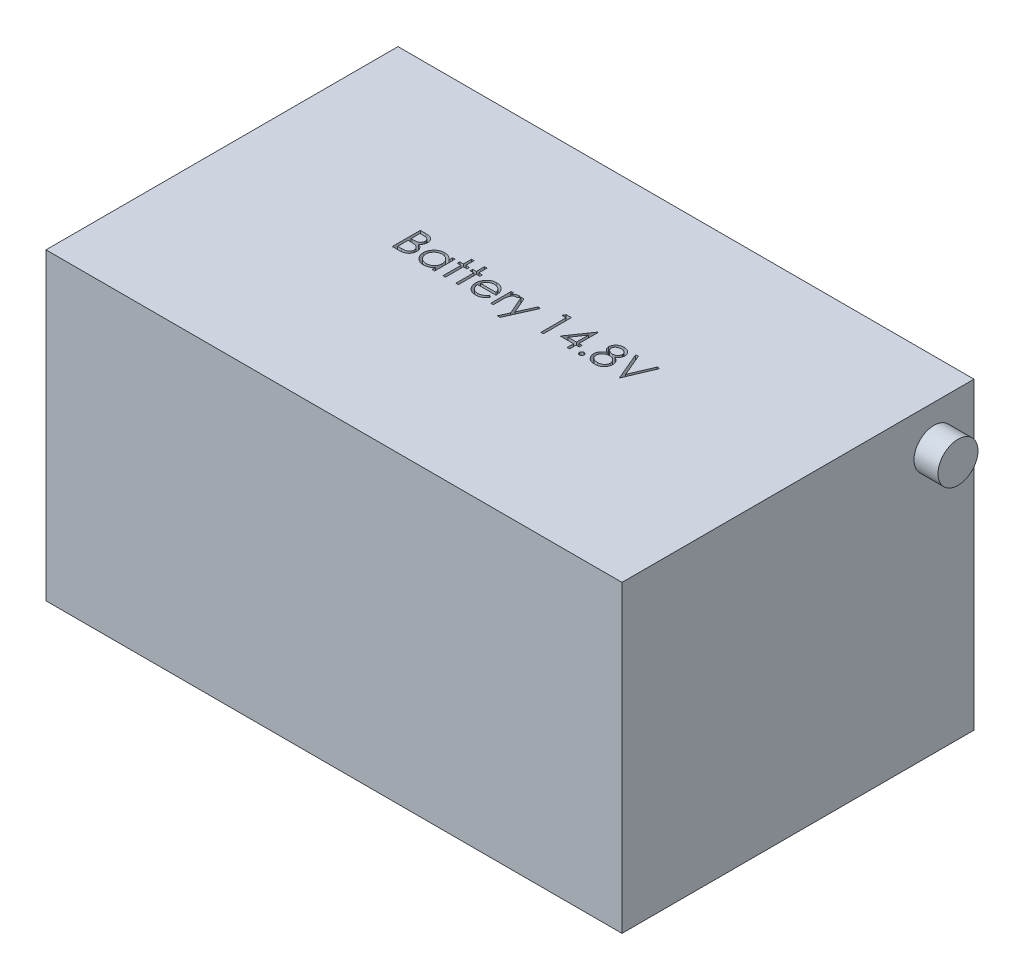
from build123d import *

# Parameters (mm, degrees)
SKETCH_1_W      = 72
SKETCH_1_H      = 38
EXTRUDE_1_DEPTH = 22
WRAP_START      = -3
WRAP_1_DEPTH    = 4
SKETCH_3_R      = 2.5
EXTRUDE_2_DEPTH = 3


with BuildPart() as part:
    # 草圖1 → 填料-伸長1 (new, symmetric)
    with BuildSketch(Plane.XY):
        Rectangle(SKETCH_1_W, SKETCH_1_H)
    extrude(amount=EXTRUDE_1_DEPTH, both=True)

    # 包覆1: read off the stored shape, not the designer's step
    # 包覆1 outline → 包覆1 (cut)
    # profile 1 of 12: a face of its own
    with BuildSketch(Plane(origin=(0, 19, 0), x_dir=(1, 0, 0), z_dir=(0, 1, 0)).offset(WRAP_START)):
        with BuildLine():
            add(Edge.make_bspline(
                [(11.850659884, 1.01943109), (11.849888464, 0.985733357), (11.848361533, 0.9190329), (11.835061549, 0.820586789), (11.815148571, 0.724975007), (11.786069058, 0.632218516), (11.748355667, 0.542829143), (11.701878831, 0.456730369), (11.649267626, 0.37251106), (11.607015387, 0.320691659), (11.585635846, 0.294471154)],
                knots=[0, 0, 0, 0, 0.128158186, 0.253673136, 0.377325306, 0.499384555, 0.622918368, 0.745839393, 0.871395285, 1, 1, 1, 1], degree=3))
            add(Edge.make_bspline(
                [(11.174077352, 1.949819712), (11.202725899, 1.934881756), (11.258600134, 1.905747753), (11.338177342, 1.858836925), (11.410902343, 1.80939596), (11.478792905, 1.759760101), (11.540656256, 1.708028449), (11.595800669, 1.653995293), (11.645588289, 1.599009348), (11.689015073, 1.542139508), (11.72721191, 1.483536859), (11.760224045, 1.423047586), (11.788441248, 1.360804252), (11.810804186, 1.296127422), (11.829225978, 1.22996716), (11.841901583, 1.161469178), (11.848718501, 1.091084837), (11.850007314, 1.043516536), (11.850659884, 1.01943109)],
                knots=[0, 0, 0, 0, 0.07952483, 0.155099976, 0.22721982, 0.295910504, 0.362055881, 0.425520117, 0.485812719, 0.544494706, 0.601459636, 0.657840594, 0.713974472, 0.769467952, 0.826129967, 0.882885359, 0.940700882, 1, 1, 1, 1], degree=3))
            add(Edge.make_bspline(
                [(11.671172705, 2.681790865), (11.669738144, 2.643814202), (11.666920749, 2.569230192), (11.643220809, 2.460503672), (11.603307496, 2.358681633), (11.548813333, 2.262608681), (11.477787845, 2.174027183), (11.391179112, 2.091810713), (11.289677634, 2.015283885), (11.213416748, 1.972097521), (11.174077352, 1.949819712)],
                knots=[0, 0, 0, 0, 0.121904041, 0.239412608, 0.355410104, 0.472090729, 0.592858982, 0.718703468, 0.854892383, 1, 1, 1, 1], degree=3))
            add(Edge.make_bspline(
                [(10.677683121, 3.58974359), (10.722186936, 3.588297247), (10.80994339, 3.585445223), (10.938938017, 3.561658345), (11.062362895, 3.521928825), (11.179792394, 3.468031602), (11.289124261, 3.401644661), (11.38572657, 3.321243787), (11.471059152, 3.231102236), (11.541643547, 3.130182633), (11.599806436, 3.023498439), (11.640307337, 2.911875918), (11.666259311, 2.797726859), (11.669532675, 2.720488855), (11.671172705, 2.681790865)],
                knots=[0, 0, 0, 0, 0.089409711, 0.176305764, 0.262625902, 0.349445726, 0.435498264, 0.51892813, 0.601354657, 0.684256422, 0.76580674, 0.844876866, 0.922279795, 1, 1, 1, 1], degree=3))
            add(Edge.make_bspline(
                [(9.651941936, 2.691606571), (9.65357736, 2.728904129), (9.656864847, 2.803878726), (9.683448168, 2.915484849), (9.726768234, 3.025101414), (9.785689231, 3.132197127), (9.859076448, 3.233147342), (9.947122993, 3.323688288), (10.04772629, 3.40299977), (10.160384157, 3.469575943), (10.281620393, 3.523759602), (10.409536117, 3.561138025), (10.54190261, 3.585574141), (10.632000329, 3.588340796), (10.677683121, 3.58974359)],
                knots=[0, 0, 0, 0, 0.074058426, 0.148870352, 0.226667668, 0.307734759, 0.391157204, 0.473929356, 0.557927752, 0.64498929, 0.733364056, 0.821092042, 0.909287215, 1, 1, 1, 1], degree=3))
            add(Edge.make_bspline(
                [(10.163059724, 1.949819712), (10.122468349, 1.97195448), (10.043872086, 2.014813588), (9.939802645, 2.093560394), (9.850412022, 2.178848209), (9.778157304, 2.272478003), (9.721285076, 2.371524878), (9.682266472, 2.47536913), (9.655869988, 2.582085244), (9.653255161, 2.65499144), (9.651941936, 2.691606571)],
                knots=[0, 0, 0, 0, 0.14586006, 0.282425903, 0.4108504, 0.535029421, 0.654701078, 0.770133433, 0.884555844, 1, 1, 1, 1], degree=3))
            add(Edge.make_bspline(
                [(9.472454756, 0.990685096), (9.473032637, 1.015244288), (9.474174734, 1.06378192), (9.482079582, 1.135491248), (9.494788044, 1.205287383), (9.5120475, 1.273428127), (9.535438527, 1.339417399), (9.56368066, 1.403567873), (9.596612612, 1.465951972), (9.634693777, 1.526910853), (9.678995801, 1.585590365), (9.729159451, 1.64298636), (9.78618732, 1.698208227), (9.849444979, 1.751930652), (9.918209518, 1.805106626), (9.994267049, 1.854862354), (10.075601317, 1.904720319), (10.133406722, 1.934528645), (10.163059724, 1.949819712)],
                knots=[0, 0, 0, 0, 0.058853586, 0.116315459, 0.172674843, 0.228780387, 0.284580359, 0.340256506, 0.396629805, 0.453507263, 0.51231819, 0.572648444, 0.636021936, 0.702362946, 0.771483056, 0.844184477, 0.920069794, 1, 1, 1, 1], degree=3))
            add(Edge.make_bspline(
                [(10.656649468, -0.08974359), (10.609636079, -0.088591112), (10.5181528, -0.086348507), (10.384994922, -0.071154075), (10.260871853, -0.044526208), (10.145061884, -0.008081599), (10.038263191, 0.039328629), (9.94078009, 0.098337038), (9.851206118, 0.16656848), (9.772259644, 0.245982558), (9.7021712, 0.331040431), (9.640603147, 0.41879204), (9.589429069, 0.509245398), (9.546101973, 0.601051765), (9.512933951, 0.695497919), (9.48996174, 0.792097932), (9.475372426, 0.890683075), (9.473431291, 0.957214728), (9.472454756, 0.990685096)],
                knots=[0, 0, 0, 0, 0.078556433, 0.15286284, 0.223559693, 0.290374944, 0.355403073, 0.418291157, 0.480388564, 0.543072615, 0.604923944, 0.664398309, 0.721942555, 0.778374891, 0.833829941, 0.888861236, 0.94408894, 1, 1, 1, 1], degree=3))
            add(Edge.make_bspline(
                [(11.585635846, 0.294471154), (11.557799372, 0.26387738), (11.502470406, 0.203067887), (11.407687478, 0.124117077), (11.303665595, 0.057767683), (11.190807262, 0.003695788), (11.06941416, -0.038390071), (10.939512156, -0.068632588), (10.800848003, -0.085955018), (10.705542532, -0.088459007), (10.656649468, -0.08974359)],
                knots=[0, 0, 0, 0, 0.11928345, 0.237092882, 0.354796044, 0.474576301, 0.597460066, 0.724926155, 0.858883199, 1, 1, 1, 1], degree=3))
        make_face()
        with BuildLine():
            add(Edge.make_bspline(
                [(9.78655732, 0.980168269), (9.787920579, 0.948737363), (9.790625253, 0.88637918), (9.812081891, 0.794216108), (9.846517427, 0.704995054), (9.894542643, 0.619443101), (9.954010215, 0.539492995), (10.027136683, 0.469804219), (10.109377521, 0.40788274), (10.203515375, 0.357802207), (10.306343841, 0.317807352), (10.41783557, 0.290251389), (10.536390489, 0.272009939), (10.618250081, 0.270171758), (10.660155077, 0.269230769)],
                knots=[0, 0, 0, 0, 0.074898208, 0.148596294, 0.224471235, 0.302322742, 0.381918618, 0.461148696, 0.542417123, 0.626716083, 0.714596831, 0.80490292, 0.900127254, 1, 1, 1, 1], degree=3))
            add(Edge.make_bspline(
                [(10.680487609, 1.75), (10.649361823, 1.749446359), (10.588300627, 1.748360249), (10.498843698, 1.736270749), (10.412990533, 1.719441356), (10.331030597, 1.693910517), (10.2529985, 1.660714027), (10.178471817, 1.620779487), (10.108020688, 1.573574044), (10.042617961, 1.519697428), (9.982894632, 1.461637975), (9.930496332, 1.400175839), (9.885998811, 1.336453307), (9.85016556, 1.269661077), (9.820753828, 1.201213466), (9.801439951, 1.129405871), (9.78905824, 1.055618758), (9.787395608, 1.00545866), (9.78655732, 0.980168269)],
                knots=[0, 0, 0, 0, 0.071268693, 0.139811785, 0.206497432, 0.271535244, 0.336081831, 0.400528388, 0.464983843, 0.530050305, 0.594423409, 0.65558271, 0.714849106, 0.772115064, 0.828999211, 0.885122163, 0.942079353, 1, 1, 1, 1], degree=3))
            add(Edge.make_bspline(
                [(11.53655732, 1.013120994), (11.535651472, 1.036998334), (11.533865297, 1.084080279), (11.522528605, 1.153846806), (11.502612728, 1.22124962), (11.475285331, 1.287099626), (11.438904369, 1.350062576), (11.396059499, 1.411778748), (11.34436538, 1.470535192), (11.285952784, 1.526788288), (11.222293823, 1.578804025), (11.154626678, 1.624818464), (11.083472216, 1.66357058), (11.008981005, 1.695087075), (10.931318449, 1.719874545), (10.850541671, 1.73719054), (10.766556096, 1.748090143), (10.709501225, 1.749356189), (10.680487609, 1.75)],
                knots=[0, 0, 0, 0, 0.057339426, 0.113063332, 0.169181449, 0.22577456, 0.283826304, 0.343454279, 0.405906962, 0.47139226, 0.538002834, 0.603063556, 0.667601831, 0.732225443, 0.79700481, 0.86304799, 0.930356987, 1, 1, 1, 1], degree=3))
            add(Edge.make_bspline(
                [(10.660155077, 0.269230769), (10.692905445, 0.269859578), (10.756713663, 0.271084698), (10.849799612, 0.281898992), (10.937644161, 0.299048617), (11.020076959, 0.323992163), (11.098020799, 0.354442139), (11.170154153, 0.393614221), (11.23833268, 0.438166544), (11.299196803, 0.491024701), (11.354630012, 0.547504195), (11.402963304, 0.607294238), (11.444920856, 0.668769871), (11.477851811, 0.733320355), (11.504178065, 0.79970727), (11.52310162, 0.868542781), (11.534777835, 0.940038014), (11.535958731, 0.988537085), (11.53655732, 1.013120994)],
                knots=[0, 0, 0, 0, 0.076558933, 0.149161352, 0.218826846, 0.285567139, 0.350313106, 0.414125154, 0.477179161, 0.540368019, 0.60220239, 0.662033654, 0.719934407, 0.775907433, 0.831114864, 0.886667447, 0.942552362, 1, 1, 1, 1], degree=3))
        make_face(mode=Mode.SUBTRACT)
        with BuildLine():
            add(Edge.make_bspline(
                [(9.9660445, 2.686698718), (9.966731867, 2.668418208), (9.968090202, 2.632293295), (9.97859533, 2.578947429), (9.994252185, 2.526525793), (10.018902847, 2.476274882), (10.048469205, 2.426451522), (10.084960681, 2.378300936), (10.128449709, 2.331655552), (10.177477149, 2.28691211), (10.230888687, 2.245013347), (10.28747273, 2.208640166), (10.346519122, 2.178206055), (10.407421191, 2.152876651), (10.470799638, 2.133186713), (10.536266112, 2.119218067), (10.603831614, 2.11053607), (10.649612195, 2.109499049), (10.672775269, 2.108974359)],
                knots=[0, 0, 0, 0, 0.05456395, 0.107826203, 0.161923709, 0.217509701, 0.274498333, 0.334814765, 0.397554947, 0.464754577, 0.53290121, 0.600097214, 0.665354161, 0.731083628, 0.796883494, 0.86329159, 0.930831218, 1, 1, 1, 1], degree=3))
            add(Edge.make_bspline(
                [(10.660155077, 3.230769231), (10.635604271, 3.23011779), (10.58757216, 3.228843288), (10.517143488, 3.222184651), (10.450171121, 3.209231434), (10.385955321, 3.191992722), (10.325376508, 3.168704734), (10.267611954, 3.141309725), (10.213644764, 3.108003659), (10.162823461, 3.070642462), (10.117072686, 3.029549555), (10.076468135, 2.986735837), (10.042740021, 2.941360445), (10.014098911, 2.894552085), (9.993317394, 2.844921509), (9.97775309, 2.793990332), (9.967231698, 2.741114948), (9.966443308, 2.704978438), (9.9660445, 2.686698718)],
                knots=[0, 0, 0, 0, 0.075243309, 0.147208812, 0.21644709, 0.284025042, 0.350655449, 0.415031318, 0.479629831, 0.544651634, 0.60804424, 0.667827565, 0.725114247, 0.780991708, 0.835527004, 0.889438155, 0.944072089, 1, 1, 1, 1], degree=3))
            add(Edge.make_bspline(
                [(11.357070141, 2.693709936), (11.356538243, 2.710337972), (11.355482503, 2.74334224), (11.346782447, 2.792080605), (11.332406614, 2.839710189), (11.312943534, 2.886624459), (11.287333739, 2.932165191), (11.256969551, 2.977048279), (11.22008505, 3.020264043), (11.178688617, 3.062819592), (11.131743208, 3.102203615), (11.079339296, 3.136838326), (11.021745545, 3.166250682), (10.958960595, 3.190139437), (10.891215671, 3.208081787), (10.818822797, 3.221518134), (10.74117835, 3.229091246), (10.687748599, 3.230197771), (10.660155077, 3.230769231)],
                knots=[0, 0, 0, 0, 0.050902438, 0.101034043, 0.151083817, 0.203061988, 0.256248434, 0.310846715, 0.3687691, 0.43001504, 0.492519647, 0.556048722, 0.621995683, 0.690192369, 0.761384855, 0.83635622, 0.915487005, 1, 1, 1, 1], degree=3))
            add(Edge.make_bspline(
                [(10.672775269, 2.108974359), (10.702525373, 2.109847226), (10.76173174, 2.111584339), (10.849011072, 2.127735513), (10.933873716, 2.153141431), (11.015412621, 2.187901397), (11.091517206, 2.231529257), (11.159357274, 2.283762275), (11.218354167, 2.343394372), (11.267894777, 2.409497208), (11.306304624, 2.479848796), (11.336206432, 2.550449089), (11.353667647, 2.62205132), (11.355945214, 2.670018284), (11.357070141, 2.693709936)],
                knots=[0, 0, 0, 0, 0.089689936, 0.17849401, 0.266837753, 0.356558176, 0.44533425, 0.530805835, 0.614076217, 0.697707086, 0.77914195, 0.855353591, 0.92855682, 1, 1, 1, 1], degree=3))
        make_face(mode=Mode.SUBTRACT)
    # profile 2 of 12: a face of its own
    with BuildSketch(Plane(origin=(0, 19, 0), x_dir=(1, 0, 0), z_dir=(0, 1, 0)).offset(WRAP_START)):
        with BuildLine():
            add(Edge.make_bspline(
                [(9.023736807, 0.246794872), (9.022541207, 0.227551542), (9.0201835, 0.189603978), (9.004920891, 0.134322516), (8.976022841, 0.084695611), (8.939787848, 0.039393473), (8.894991415, 0.002452603), (8.844889568, -0.024970742), (8.78989831, -0.041662722), (8.751581987, -0.043789019), (8.732070141, -0.044871795)],
                knots=[0, 0, 0, 0, 0.126177718, 0.248820607, 0.371539969, 0.499983707, 0.627244198, 0.749225521, 0.87229795, 1, 1, 1, 1], degree=3))
            add(Edge.make_bspline(
                [(8.732070141, 0.538461538), (8.751560353, 0.537303372), (8.789768635, 0.535032921), (8.845007764, 0.519456248), (8.895002423, 0.491797587), (8.939534668, 0.454934809), (8.976241145, 0.410239146), (9.004885497, 0.360643237), (9.020326482, 0.304941644), (9.022580394, 0.266511969), (9.023736807, 0.246794872)],
                knots=[0, 0, 0, 0, 0.127518927, 0.249985948, 0.371792352, 0.498870353, 0.625948354, 0.748491738, 0.870958759, 1, 1, 1, 1], degree=3))
            add(Edge.make_bspline(
                [(8.440403474, 0.246794872), (8.441465573, 0.266544251), (8.443539192, 0.305102491), (8.460314852, 0.360301599), (8.487691064, 0.410470038), (8.524696459, 0.454866618), (8.569220755, 0.492053921), (8.61951696, 0.519118714), (8.6745565, 0.535159126), (8.712566439, 0.537341643), (8.732070141, 0.538461538)],
                knots=[0, 0, 0, 0, 0.129096958, 0.252045967, 0.373904964, 0.501037835, 0.628170706, 0.751376463, 0.872426013, 1, 1, 1, 1], degree=3))
            add(Edge.make_bspline(
                [(8.732070141, -0.044871795), (8.712544235, -0.043828198), (8.674424552, -0.041790823), (8.619638558, -0.024628016), (8.56923159, 0.002195444), (8.524443878, 0.039462353), (8.487905406, 0.084462497), (8.460280023, 0.134664293), (8.443689874, 0.189445731), (8.441508002, 0.227520373), (8.440403474, 0.246794872)],
                knots=[0, 0, 0, 0, 0.127756603, 0.249414355, 0.372796476, 0.500111333, 0.628609941, 0.750643374, 0.873768379, 1, 1, 1, 1], degree=3))
        make_face()
    # profile 3 of 12: a face of its own
    with BuildSketch(Plane(origin=(0, 19, 0), x_dir=(1, 0, 0), z_dir=(0, 1, 0)).offset(WRAP_START)):
        with BuildLine():
            add(Edge.make_bspline(
                [(-2.104468321, 2.181189904), (-2.081279562, 2.216245732), (-2.036931241, 2.283289731), (-1.963218312, 2.371959032), (-1.887714981, 2.445374079), (-1.810059793, 2.503877598), (-1.729681693, 2.547690717), (-1.648344742, 2.579783752), (-1.564769272, 2.598761067), (-1.508607347, 2.601294726), (-1.480469923, 2.602564103)],
                knots=[0, 0, 0, 0, 0.160059412, 0.306112383, 0.438366514, 0.560541455, 0.675317225, 0.786113634, 0.892841788, 1, 1, 1, 1], degree=3))
            Line((-2.104468321, 2.181189904), (-2.104468321, 2.557692308))
            Line((-2.104468321, 2.557692308), (-2.418570885, 2.557692308))
            Line((-2.418570885, 2.557692308), (-2.418570885, 0))
            Line((-2.418570885, 0), (-2.104468321, 0))
            Line((-2.104468321, 0), (-2.104468321, 0.859575321))
            add(Edge.make_bspline(
                [(-2.048378577, 1.737379808), (-2.053110971, 1.717102634), (-2.063592862, 1.672190235), (-2.0737844, 1.596841711), (-2.083853918, 1.507818052), (-2.090950536, 1.404871459), (-2.097528579, 1.288259015), (-2.101238661, 1.15780307), (-2.104341801, 1.013369718), (-2.104424868, 0.912395365), (-2.104468321, 0.859575321)],
                knots=[0, 0, 0, 0, 0.070854869, 0.15693815, 0.258600395, 0.37589093, 0.508166168, 0.656237809, 0.82017677, 1, 1, 1, 1], degree=3))
            add(Edge.make_bspline(
                [(-1.540065276, 2.288461538), (-1.565271009, 2.286781501), (-1.616683399, 2.283354712), (-1.692167899, 2.256415904), (-1.765415104, 2.212890664), (-1.823586767, 2.164619552), (-1.86862902, 2.118071755), (-1.900769245, 2.077423352), (-1.930251992, 2.031844721), (-1.958422212, 1.982115037), (-1.984088507, 1.927385191), (-2.008043176, 1.868201977), (-2.029702039, 1.804496849), (-2.042052283, 1.760114328), (-2.048378577, 1.737379808)],
                knots=[0, 0, 0, 0, 0.093806529, 0.191338128, 0.295190617, 0.410312337, 0.471930251, 0.536425159, 0.603118728, 0.674117672, 0.749332023, 0.828283384, 0.912039809, 1, 1, 1, 1], degree=3))
            add(Edge.make_bspline(
                [(-1.379508385, 2.242888622), (-1.394617406, 2.249628888), (-1.423297221, 2.262423203), (-1.465251787, 2.277565213), (-1.503933124, 2.286481129), (-1.528576682, 2.287831847), (-1.540065276, 2.288461538)],
                knots=[0, 0, 0, 0, 0.295138801, 0.560229945, 0.794983357, 1, 1, 1, 1], degree=3))
            Line((-1.379508385, 2.242888622), (-1.207032423, 2.514923878))
            add(Edge.make_bspline(
                [(-1.480469923, 2.602564103), (-1.458643597, 2.601373576), (-1.413734512, 2.59892399), (-1.345751922, 2.581713165), (-1.27570847, 2.554235143), (-1.230566083, 2.52839492), (-1.207032423, 2.514923878)],
                knots=[0, 0, 0, 0, 0.225277548, 0.463523195, 0.720323555, 1, 1, 1, 1], degree=3))
        make_face()
    # profile 4 of 12: a face of its own
    with BuildSketch(Plane(origin=(0, 19, 0), x_dir=(1, 0, 0), z_dir=(0, 1, 0)).offset(WRAP_START)):
        with BuildLine():
            add(Edge.make_bspline(
                [(-3.091647808, 0.661157853), (-3.113884403, 0.621714521), (-3.157148012, 0.544973418), (-3.23154876, 0.439541558), (-3.309540832, 0.344693842), (-3.3946448, 0.262964188), (-3.484314479, 0.191712803), (-3.579047134, 0.129374978), (-3.679335952, 0.076256458), (-3.785185676, 0.03150393), (-3.897485228, -0.002905564), (-4.016506744, -0.027209785), (-4.142478239, -0.042233054), (-4.228824419, -0.043978194), (-4.273038032, -0.044871795)],
                knots=[0, 0, 0, 0, 0.093369857, 0.181660766, 0.265874227, 0.346354784, 0.424599862, 0.501903184, 0.579992091, 0.658443431, 0.738672236, 0.821894148, 0.908800792, 1, 1, 1, 1], degree=3))
            Line((-3.091647808, 0.661157853), (-3.370694282, 0.807692308))
            add(Edge.make_bspline(
                [(-4.312300853, 0.269230769), (-4.280949705, 0.269838826), (-4.218743014, 0.271045327), (-4.126102157, 0.282777238), (-4.03496263, 0.301747513), (-3.945701646, 0.327637504), (-3.8601308, 0.359214356), (-3.78088525, 0.397317213), (-3.708005035, 0.43946696), (-3.639888068, 0.487676635), (-3.573817075, 0.546684822), (-3.508274588, 0.620320543), (-3.437997935, 0.707408071), (-3.394008342, 0.772953737), (-3.370694282, 0.807692308)],
                knots=[0, 0, 0, 0, 0.082592263, 0.163878894, 0.24565874, 0.327725695, 0.408609961, 0.485749086, 0.559169056, 0.630268476, 0.705306028, 0.792064966, 0.889796437, 1, 1, 1, 1], degree=3))
            add(Edge.make_bspline(
                [(-5.245493962, 1.211538462), (-5.243954355, 1.177837997), (-5.240926781, 1.111567394), (-5.226811638, 1.01459661), (-5.204562865, 0.922223268), (-5.173293802, 0.835140226), (-5.135426957, 0.752210099), (-5.08904124, 0.674048062), (-5.033701686, 0.601010132), (-4.971975987, 0.532442994), (-4.903268891, 0.471382233), (-4.830986144, 0.416730457), (-4.754092579, 0.37092486), (-4.673194495, 0.33374497), (-4.58842271, 0.304638654), (-4.499750515, 0.284770834), (-4.407352399, 0.271463727), (-4.344366665, 0.269984061), (-4.312300853, 0.269230769)],
                knots=[0, 0, 0, 0, 0.068384615, 0.134475588, 0.198391058, 0.260753477, 0.321829223, 0.383037238, 0.444653123, 0.507398011, 0.569825238, 0.630777641, 0.690928687, 0.750945133, 0.811049477, 0.872330853, 0.935004094, 1, 1, 1, 1], degree=3))
            Line((-5.245493962, 1.211538462), (-2.957032423, 1.211538462))
            add(Edge.make_bspline(
                [(-3.235377776, 2.099158654), (-3.213250838, 2.068955072), (-3.169144245, 2.008748954), (-3.113897145, 1.910577797), (-3.06593975, 1.807867202), (-3.027606789, 1.698956905), (-2.996567287, 1.585137325), (-2.974110469, 1.46559478), (-2.96094085, 1.340364869), (-2.958352153, 1.255038314), (-2.957032423, 1.211538462)],
                knots=[0, 0, 0, 0, 0.11852184, 0.236254763, 0.356174434, 0.477249655, 0.601539871, 0.729618382, 0.862158266, 1, 1, 1, 1], degree=3))
            add(Edge.make_bspline(
                [(-4.265325693, 2.602564103), (-4.212878087, 2.601210054), (-4.109987841, 2.598553718), (-3.95995572, 2.573927385), (-3.817995004, 2.53487483), (-3.684162499, 2.47972104), (-3.558444639, 2.408561488), (-3.441658589, 2.320419647), (-3.331807077, 2.218001559), (-3.267898498, 2.13923835), (-3.235377776, 2.099158654)],
                knots=[0, 0, 0, 0, 0.132040234, 0.259032841, 0.381879824, 0.502258444, 0.62275219, 0.744742632, 0.870108927, 1, 1, 1, 1], degree=3))
            add(Edge.make_bspline(
                [(-5.265125372, 2.125801282), (-5.233417689, 2.163670152), (-5.171006743, 2.238208303), (-5.065450387, 2.336146628), (-4.951150191, 2.418190404), (-4.829538565, 2.48619754), (-4.699202091, 2.537871187), (-4.5618928, 2.576378769), (-4.416047214, 2.59795678), (-4.316341993, 2.601004614), (-4.265325693, 2.602564103)],
                knots=[0, 0, 0, 0, 0.128835254, 0.253589335, 0.374643257, 0.495340042, 0.616324775, 0.739759335, 0.86684232, 1, 1, 1, 1], degree=3))
            add(Edge.make_bspline(
                [(-5.559596526, 1.271834936), (-5.558537385, 1.311129766), (-5.556438306, 1.389006931), (-5.543207519, 1.504272476), (-5.519759226, 1.616300928), (-5.487582902, 1.725185376), (-5.446031656, 1.83074351), (-5.395199437, 1.933039574), (-5.335007059, 2.031964713), (-5.288534385, 2.094367847), (-5.265125372, 2.125801282)],
                knots=[0, 0, 0, 0, 0.128044808, 0.2537679, 0.377428427, 0.500550841, 0.623295883, 0.746578332, 0.872347541, 1, 1, 1, 1], degree=3))
            add(Edge.make_bspline(
                [(-4.273038032, -0.044871795), (-4.32218001, -0.04372462), (-4.418041772, -0.041486813), (-4.557581519, -0.022194348), (-4.688960937, 0.00927801), (-4.81217264, 0.053243552), (-4.926914893, 0.110670876), (-5.033415748, 0.180630358), (-5.132235274, 0.262762612), (-5.220259483, 0.357779056), (-5.299503366, 0.459461013), (-5.369429186, 0.565416898), (-5.427886617, 0.675380122), (-5.475439227, 0.788650646), (-5.513844092, 0.90451454), (-5.540610796, 1.024026007), (-5.556040544, 1.146861592), (-5.558404989, 1.229958927), (-5.559596526, 1.271834936)],
                knots=[0, 0, 0, 0, 0.071578658, 0.139629225, 0.204796697, 0.268134963, 0.329813747, 0.391301398, 0.453433515, 0.51655169, 0.579631271, 0.641118921, 0.701294047, 0.760810336, 0.819931722, 0.878919575, 0.938982822, 1, 1, 1, 1], degree=3))
        make_face()
        with BuildLine():
            add(Edge.make_bspline(
                [(-4.249199891, 2.288461538), (-4.28054933, 2.287849867), (-4.342520579, 2.286640721), (-4.433821647, 2.275170592), (-4.521501346, 2.256210747), (-4.606206634, 2.23024579), (-4.686827502, 2.195637188), (-4.76502227, 2.155053961), (-4.838802666, 2.105512377), (-4.884943962, 2.067753522), (-4.908254379, 2.048677885)],
                knots=[0, 0, 0, 0, 0.131091976, 0.259141276, 0.384161763, 0.505991952, 0.629098089, 0.750669123, 0.874038938, 1, 1, 1, 1], degree=3))
            add(Edge.make_bspline(
                [(-3.271134987, 1.525641026), (-3.282631612, 1.567303899), (-3.304758914, 1.64749152), (-3.350995278, 1.75853241), (-3.403066819, 1.857220311), (-3.46468855, 1.942799944), (-3.534507276, 2.018803457), (-3.615152458, 2.085222043), (-3.705588352, 2.144639494), (-3.805347492, 2.194791993), (-3.910989278, 2.237481852), (-4.02159547, 2.266106968), (-4.134453257, 2.28571651), (-4.210787544, 2.287542618), (-4.249199891, 2.288461538)],
                knots=[0, 0, 0, 0, 0.096240125, 0.185231261, 0.267500523, 0.344400382, 0.419594869, 0.496890627, 0.576637919, 0.660267852, 0.745386615, 0.830040327, 0.914474212, 1, 1, 1, 1], degree=3))
            Line((-3.271134987, 1.525641026), (-5.212541237, 1.525641026))
            add(Edge.make_bspline(
                [(-4.908254379, 2.048677885), (-4.92494766, 2.033583569), (-4.958730795, 2.003036353), (-5.003871316, 1.950407146), (-5.047091789, 1.893655584), (-5.086425442, 1.83061046), (-5.122503028, 1.761989681), (-5.156263005, 1.688372045), (-5.186649417, 1.609198915), (-5.203745527, 1.554026476), (-5.212541237, 1.525641026)],
                knots=[0, 0, 0, 0, 0.109983845, 0.222580497, 0.338499871, 0.458708565, 0.585535346, 0.717517743, 0.85466682, 1, 1, 1, 1], degree=3))
        make_face(mode=Mode.SUBTRACT)
    # profile 5 of 12: a face of its own
    with BuildSketch(Plane(origin=(0, 19, 0), x_dir=(1, 0, 0), z_dir=(0, 1, 0)).offset(WRAP_START)):
        with BuildLine():
            add(Edge.make_bspline(
                [(-9.732673449, 0.442407853), (-9.76809224, 0.402368259), (-9.837212455, 0.324230488), (-9.952653573, 0.222148315), (-10.075021751, 0.137769993), (-10.203723072, 0.069620078), (-10.338641315, 0.018428021), (-10.479477403, -0.017958138), (-10.626288783, -0.041351973), (-10.726541138, -0.043687995), (-10.777344923, -0.044871795)],
                knots=[0, 0, 0, 0, 0.134298379, 0.262084975, 0.386269912, 0.507164597, 0.627300236, 0.748144942, 0.872370177, 1, 1, 1, 1], degree=3))
            Line((-9.732673449, 0.442407853), (-9.732673449, 0))
            Line((-9.732673449, 0), (-9.418570885, 0))
            Line((-9.418570885, 0), (-9.418570885, 2.557692308))
            Line((-9.418570885, 2.557692308), (-9.732673449, 2.557692308))
            Line((-9.732673449, 2.557692308), (-9.732673449, 2.084435096))
            add(Edge.make_bspline(
                [(-10.767529218, 2.602564103), (-10.715329359, 2.601126351), (-10.612967899, 2.598306988), (-10.46323989, 2.574844261), (-10.321595412, 2.535205794), (-10.18694106, 2.481288296), (-10.059760374, 2.409639567), (-9.94125739, 2.319259606), (-9.830191906, 2.210718419), (-9.765811615, 2.127347974), (-9.732673449, 2.084435096)],
                knots=[0, 0, 0, 0, 0.129862142, 0.254653531, 0.376014554, 0.495255252, 0.614797719, 0.738105554, 0.8651963, 1, 1, 1, 1], degree=3))
            add(Edge.make_bspline(
                [(-12.110878577, 1.285857372), (-12.109625606, 1.330321075), (-12.107148549, 1.418223419), (-12.088695329, 1.547502117), (-12.057664321, 1.672020377), (-12.014116473, 1.791377321), (-11.958274518, 1.905717371), (-11.890346431, 2.015121396), (-11.810327306, 2.119890793), (-11.718074899, 2.21756202), (-11.618140129, 2.307782634), (-11.511231398, 2.38619168), (-11.400008117, 2.453908529), (-11.282745106, 2.507562005), (-11.161178001, 2.550971109), (-11.034224556, 2.581004078), (-10.902412977, 2.598701399), (-10.812922485, 2.601264163), (-10.767529218, 2.602564103)],
                knots=[0, 0, 0, 0, 0.063774532, 0.12607881, 0.186904093, 0.247573935, 0.308003356, 0.369131898, 0.432033228, 0.496790794, 0.561610823, 0.624913866, 0.686726349, 0.748078833, 0.809582291, 0.871630743, 0.934885821, 1, 1, 1, 1], degree=3))
            add(Edge.make_bspline(
                [(-10.777344923, -0.044871795), (-10.822512877, -0.043645423), (-10.911586082, -0.041226962), (-11.042615159, -0.022464659), (-11.168707409, 0.007665963), (-11.289981981, 0.049566853), (-11.405654127, 0.105147674), (-11.516714223, 0.171688922), (-11.622586915, 0.250929752), (-11.721658454, 0.341517781), (-11.812890455, 0.439912768), (-11.892951727, 0.544858315), (-11.959704807, 0.655900619), (-12.015524888, 0.771633773), (-12.058521232, 0.892948692), (-12.088494867, 1.01942586), (-12.107235313, 1.150915734), (-12.109652774, 1.240455257), (-12.110878577, 1.285857372)],
                knots=[0, 0, 0, 0, 0.064619991, 0.127433484, 0.189004127, 0.249930071, 0.310668454, 0.372328961, 0.43493911, 0.499575544, 0.564191208, 0.626735217, 0.688109334, 0.749293607, 0.810330528, 0.87190117, 0.935045915, 1, 1, 1, 1], degree=3))
        make_face()
        with BuildLine():
            add(Edge.make_bspline(
                [(-11.796776013, 1.282351763), (-11.79491112, 1.238761656), (-11.791188643, 1.1517523), (-11.764437949, 1.022771723), (-11.719558075, 0.897117681), (-11.658316012, 0.775856687), (-11.581629388, 0.663272587), (-11.492740735, 0.561532464), (-11.390790454, 0.474042876), (-11.277862947, 0.400805303), (-11.157254976, 0.341642782), (-11.030421045, 0.300477142), (-10.899745407, 0.273899362), (-10.810893073, 0.270794885), (-10.766126975, 0.269230769)],
                knots=[0, 0, 0, 0, 0.081589349, 0.162858895, 0.245483689, 0.330807139, 0.416493374, 0.499893203, 0.583048156, 0.667157852, 0.751311929, 0.833784789, 0.916256489, 1, 1, 1, 1], degree=3))
            add(Edge.make_bspline(
                [(-10.763322487, 2.288461538), (-10.809236825, 2.286827901), (-10.899864425, 2.28360336), (-11.032908427, 2.258429865), (-11.160221841, 2.21654527), (-11.281167916, 2.159263369), (-11.393836132, 2.087234632), (-11.494529803, 2.000113249), (-11.584072505, 1.900276235), (-11.659380769, 1.788174125), (-11.720771266, 1.667996033), (-11.763938298, 1.542371595), (-11.792407545, 1.413566618), (-11.795316066, 1.326203932), (-11.796776013, 1.282351763)],
                knots=[0, 0, 0, 0, 0.085920517, 0.169593435, 0.252475515, 0.336244477, 0.419504521, 0.502035907, 0.584774648, 0.669846475, 0.754184866, 0.836658238, 0.918009726, 1, 1, 1, 1], degree=3))
            add(Edge.make_bspline(
                [(-9.732673449, 1.273237179), (-9.733633105, 1.30857501), (-9.735522013, 1.378131043), (-9.749952582, 1.480258561), (-9.772907509, 1.577992287), (-9.805253679, 1.671434976), (-9.847744963, 1.760069991), (-9.898992729, 1.844533752), (-9.959898179, 1.924386963), (-10.029480875, 1.998530034), (-10.105646077, 2.066156496), (-10.186240618, 2.126520737), (-10.272219365, 2.17610951), (-10.362136402, 2.217150781), (-10.456147736, 2.249809931), (-10.555018356, 2.271597625), (-10.657697343, 2.286557946), (-10.727743399, 2.287820327), (-10.763322487, 2.288461538)],
                knots=[0, 0, 0, 0, 0.0656338, 0.129188088, 0.191218683, 0.251912818, 0.312507474, 0.373494434, 0.4351516, 0.498741474, 0.562095217, 0.624186567, 0.685475718, 0.746096815, 0.807611636, 0.869966581, 0.933951019, 1, 1, 1, 1], degree=3))
            add(Edge.make_bspline(
                [(-10.766126975, 0.269230769), (-10.720680472, 0.270890733), (-10.630291885, 0.274192237), (-10.496853178, 0.299473502), (-10.367358215, 0.3412423), (-10.243570986, 0.399141427), (-10.128254855, 0.470898783), (-10.024756978, 0.554905874), (-9.937241009, 0.652609058), (-9.8630484, 0.759985511), (-9.804872983, 0.877697508), (-9.762496924, 1.003031698), (-9.737443018, 1.135992447), (-9.734285288, 1.226856374), (-9.732673449, 1.273237179)],
                knots=[0, 0, 0, 0, 0.084802388, 0.16866354, 0.252551924, 0.338239689, 0.423102661, 0.505556051, 0.586175656, 0.66713572, 0.74849918, 0.830452399, 0.913455706, 1, 1, 1, 1], degree=3))
        make_face(mode=Mode.SUBTRACT)
    # profile 6 of 12: a face of its own
    with BuildSketch(Plane(origin=(0, 19, 0), x_dir=(1, 0, 0), z_dir=(0, 1, 0)).offset(WRAP_START)):
        with BuildLine():
            add(Edge.make_bspline(
                [(-14.030550052, 3.5), (-13.997121573, 3.49982425), (-13.932328863, 3.499483602), (-13.838109421, 3.49420047), (-13.749860611, 3.486996801), (-13.667556838, 3.475566708), (-13.591236136, 3.461774931), (-13.520668499, 3.445073115), (-13.456078326, 3.425046501), (-13.37896559, 3.39320022), (-13.291044929, 3.345877051), (-13.195846536, 3.275948486), (-13.114442297, 3.190416023), (-13.04425598, 3.093933368), (-12.98845486, 2.987797596), (-12.948085563, 2.874538407), (-12.922527687, 2.755616665), (-12.919899253, 2.673973487), (-12.918570885, 2.63271234)],
                knots=[0, 0, 0, 0, 0.062594097, 0.121322939, 0.176680142, 0.228365096, 0.276868446, 0.321879128, 0.364098625, 0.403355696, 0.477967948, 0.550535461, 0.623584457, 0.698174882, 0.77335367, 0.847281125, 0.92281834, 1, 1, 1, 1], degree=3))
            Line((-14.030550052, 3.5), (-14.71344268, 3.5))
            Line((-14.71344268, 3.5), (-14.71344268, 0))
            Line((-14.71344268, 0), (-13.766928257, 0))
            add(Edge.make_bspline(
                [(-12.649340116, 0.993489583), (-12.650316962, 0.959322711), (-12.652238934, 0.892098433), (-12.666418905, 0.793343299), (-12.690428012, 0.698968352), (-12.723499159, 0.608363169), (-12.766661473, 0.521703035), (-12.819189438, 0.438889771), (-12.881821001, 0.36075544), (-12.95188387, 0.286431817), (-13.031146016, 0.21960403), (-13.116661771, 0.160088323), (-13.209508091, 0.111142261), (-13.308160085, 0.070026239), (-13.413724401, 0.038619041), (-13.525727008, 0.016646467), (-13.64407131, 0.00184143), (-13.725281061, 0.000624225), (-13.766928257, 0)],
                knots=[0, 0, 0, 0, 0.061160277, 0.120334558, 0.178180255, 0.235235126, 0.292682961, 0.351186248, 0.41045661, 0.471719854, 0.533761203, 0.595739024, 0.657887515, 0.72129518, 0.786822515, 0.854686154, 0.925477986, 1, 1, 1, 1], degree=3))
            add(Edge.make_bspline(
                [(-13.323118161, 1.888120994), (-13.283357733, 1.872855995), (-13.207286186, 1.84365027), (-13.102600173, 1.792014806), (-13.012405328, 1.735852696), (-12.936008182, 1.674520846), (-12.870670527, 1.608412035), (-12.813617586, 1.536556921), (-12.764936212, 1.458018163), (-12.723223288, 1.373614627), (-12.690674532, 1.284208159), (-12.666298628, 1.190637383), (-12.652331178, 1.093237828), (-12.650343537, 1.026952448), (-12.649340116, 0.993489583)],
                knots=[0, 0, 0, 0, 0.106057493, 0.202914257, 0.290300165, 0.370222566, 0.446383721, 0.5213969, 0.598291083, 0.676142469, 0.7555287, 0.834887172, 0.916646049, 1, 1, 1, 1], degree=3))
            add(Edge.make_bspline(
                [(-12.918570885, 2.63271234), (-12.919664103, 2.594059784), (-12.921812381, 2.518103867), (-12.94235514, 2.407009758), (-12.974515808, 2.301258539), (-13.019221058, 2.201236154), (-13.077323054, 2.10920254), (-13.146181373, 2.024415274), (-13.229258175, 1.950464217), (-13.291501415, 1.909121315), (-13.323118161, 1.888120994)],
                knots=[0, 0, 0, 0, 0.130569107, 0.256580609, 0.380551617, 0.503622917, 0.625739323, 0.747548582, 0.871766119, 1, 1, 1, 1], degree=3))
        make_face()
        with BuildLine():
            add(Edge.make_bspline(
                [(-13.952024411, 0.358974359), (-13.920005485, 0.359358106), (-13.858293226, 0.360097729), (-13.769191996, 0.362512283), (-13.686608892, 0.368004559), (-13.610920756, 0.376650409), (-13.541310304, 0.386028858), (-13.478612601, 0.398640139), (-13.422319407, 0.413089099), (-13.3570451, 0.435423272), (-13.283541591, 0.470119743), (-13.204330735, 0.522433969), (-13.133904517, 0.584757277), (-13.074099258, 0.656888191), (-13.025086269, 0.735319518), (-12.989430814, 0.818464868), (-12.967439957, 0.904950395), (-12.964777788, 0.963917108), (-12.96344268, 0.993489583)],
                knots=[0, 0, 0, 0, 0.072502489, 0.139738989, 0.201795135, 0.259821934, 0.312205989, 0.360773434, 0.404540343, 0.443698099, 0.516840794, 0.587874336, 0.657965418, 0.728969389, 0.79930772, 0.866635778, 0.933116329, 1, 1, 1, 1], degree=3))
            Line((-13.952024411, 0.358974359), (-14.399340116, 0.358974359))
            Line((-14.399340116, 0.358974359), (-14.399340116, 1.66025641))
            Line((-14.399340116, 1.66025641), (-14.191106943, 1.66025641))
            add(Edge.make_bspline(
                [(-13.536259186, 1.618890224), (-13.553288282, 1.622345308), (-13.590210874, 1.629836643), (-13.650418455, 1.637744346), (-13.719154324, 1.644789406), (-13.796577201, 1.650000564), (-13.882785042, 1.655387107), (-13.977961961, 1.657481929), (-14.081719275, 1.659981189), (-14.153711648, 1.660162323), (-14.191106943, 1.66025641)],
                knots=[0, 0, 0, 0, 0.079306486, 0.171952819, 0.277056507, 0.394730576, 0.526177321, 0.671344767, 0.829285257, 1, 1, 1, 1], degree=3))
            add(Edge.make_bspline(
                [(-12.96344268, 0.993489583), (-12.963718784, 1.011982924), (-12.964266539, 1.048671306), (-12.972527154, 1.102587125), (-12.984541024, 1.154812998), (-13.000072458, 1.205490739), (-13.022691925, 1.253704115), (-13.04909847, 1.300406674), (-13.080059872, 1.345660154), (-13.128304037, 1.402872407), (-13.198476022, 1.46878942), (-13.298182797, 1.533326923), (-13.411555095, 1.58537473), (-13.493782588, 1.607474206), (-13.536259186, 1.618890224)],
                knots=[0, 0, 0, 0, 0.060287398, 0.119602355, 0.177503371, 0.235142664, 0.292132593, 0.350871209, 0.410097863, 0.470731522, 0.594828704, 0.722578824, 0.85669139, 1, 1, 1, 1], degree=3))
        make_face(mode=Mode.SUBTRACT)
        with BuildLine():
            add(Edge.make_bspline(
                [(-14.188302455, 2.019230769), (-14.15745366, 2.019630692), (-14.097847501, 2.020403425), (-14.011527604, 2.022616942), (-13.931402586, 2.028814985), (-13.857610753, 2.035011248), (-13.790268309, 2.045085835), (-13.729524448, 2.057077958), (-13.674425851, 2.069760863), (-13.610886305, 2.09133035), (-13.538813357, 2.123208025), (-13.461980252, 2.172679861), (-13.394245783, 2.231604215), (-13.337048595, 2.299595176), (-13.290237125, 2.374461362), (-13.257723409, 2.455008243), (-13.235676125, 2.539228375), (-13.233684594, 2.597046627), (-13.232673449, 2.626402244)],
                knots=[0, 0, 0, 0, 0.072301034, 0.139700332, 0.202288511, 0.260599533, 0.313190329, 0.361738933, 0.405706476, 0.445539985, 0.518831956, 0.58977824, 0.658867479, 0.728430478, 0.797282704, 0.864815377, 0.931363753, 1, 1, 1, 1], degree=3))
            Line((-14.188302455, 2.019230769), (-14.399340116, 2.019230769))
            Line((-14.399340116, 2.019230769), (-14.399340116, 3.141025641))
            Line((-14.399340116, 3.141025641), (-13.973058064, 3.141025641))
            add(Edge.make_bspline(
                [(-13.232673449, 2.626402244), (-13.233199629, 2.645828015), (-13.234231789, 2.683933787), (-13.242685092, 2.739483141), (-13.257052666, 2.791726894), (-13.275506959, 2.841381004), (-13.301295648, 2.886892854), (-13.331659111, 2.92983605), (-13.368344802, 2.968748169), (-13.410102114, 3.005117667), (-13.458110737, 3.037362195), (-13.512342029, 3.065602958), (-13.573529706, 3.088343735), (-13.640642561, 3.108259887), (-13.714713649, 3.122248181), (-13.794888202, 3.133901569), (-13.881822921, 3.139834311), (-13.941968024, 3.140619673), (-13.973058064, 3.141025641)],
                knots=[0, 0, 0, 0, 0.057003133, 0.111817869, 0.164402372, 0.215869805, 0.26684111, 0.317478963, 0.369902136, 0.423400449, 0.479718398, 0.539241497, 0.602430689, 0.671029546, 0.744484798, 0.823453971, 0.908740313, 1, 1, 1, 1], degree=3))
        make_face(mode=Mode.SUBTRACT)
    # profile 7 of 12: a face of its own
    with BuildSketch(Plane(origin=(0, 19, 0), x_dir=(1, 0, 0), z_dir=(0, 1, 0)).offset(WRAP_START)):
        Polygon((14.879506038, 3.5), (13.712839371, 0.741786859), (12.546172705, 3.5), (12.209634243, 3.5), (13.690403474, 0), (13.735275269, 0), (15.2160445, 3.5), align=None)
    # profile 8 of 12: a face of its own
    with BuildSketch(Plane(origin=(0, 19, 0), x_dir=(1, 0, 0), z_dir=(0, 1, 0)).offset(WRAP_START)):
        Polygon((4.177582961, 0), (4.177582961, 3.5), (3.530447545, 3.5), (3.325018859, 3.141025641), (3.863480397, 3.141025641), (3.863480397, 0), align=None)
    # profile 9 of 12: a face of its own
    with BuildSketch(Plane(origin=(0, 19, 0), x_dir=(1, 0, 0), z_dir=(0, 1, 0)).offset(WRAP_START)):
        Polygon((7.139121423, 0.807692308), (7.139121423, 0), (7.453223987, 0), (7.453223987, 0.807692308), (7.857070141, 0.807692308), (7.857070141, 1.166666667), (7.453223987, 1.166666667), (7.453223987, 3.58974359), (7.389421904, 3.58974359), (5.478865013, 0.807692308), align=None)
        Polygon((7.139121423, 2.686698718), (7.139121423, 1.166666667), (6.095852192, 1.166666667), align=None, mode=Mode.SUBTRACT)
    # profile 10 of 12: a face of its own
    with BuildSketch(Plane(origin=(0, 19, 0), x_dir=(1, 0, 0), z_dir=(0, 1, 0)).offset(WRAP_START)):
        Polygon((-6.771134987, 2.243589744), (-6.771134987, 0), (-6.457032423, 0), (-6.457032423, 2.243589744), (-6.008314475, 2.243589744), (-6.008314475, 2.557692308), (-6.457032423, 2.557692308), (-6.457032423, 3.58974359), (-6.771134987, 3.58974359), (-6.771134987, 2.557692308), (-7.219852936, 2.557692308), (-7.219852936, 2.243589744), align=None)
    # profile 11 of 12: a face of its own
    with BuildSketch(Plane(origin=(0, 19, 0), x_dir=(1, 0, 0), z_dir=(0, 1, 0)).offset(WRAP_START)):
        Polygon((-8.386519603, 2.243589744), (-8.386519603, 0), (-8.072417039, 0), (-8.072417039, 2.243589744), (-7.62369909, 2.243589744), (-7.62369909, 2.557692308), (-8.072417039, 2.557692308), (-8.072417039, 3.58974359), (-8.386519603, 3.58974359), (-8.386519603, 2.557692308), (-8.835237552, 2.557692308), (-8.835237552, 2.243589744), align=None)
    # profile 12 of 12: a face of its own
    with BuildSketch(Plane(origin=(0, 19, 0), x_dir=(1, 0, 0), z_dir=(0, 1, 0)).offset(WRAP_START)):
        Polygon((0.921573346, 2.557692308), (0.042366615, 0.598758013), (-0.823518802, 2.557692308), (-1.162160629, 2.557692308), (-0.128005981, 0.218048878), (-0.648939475, -0.942307692), (-0.309596526, -0.942307692), (1.260916295, 2.557692308), align=None)
    extrude(amount=WRAP_1_DEPTH, mode=Mode.SUBTRACT)

    # 草圖3 → 填料-伸長2 (add)
    with BuildSketch(Plane(origin=(36, 0, 0), x_dir=(0, 0, -1), z_dir=(1, 0, 0))):
        with Locations(Location((17, 14, 0), (0, 0, 270))):
            Circle(SKETCH_3_R)
    extrude(amount=EXTRUDE_2_DEPTH)


solid = part.part
